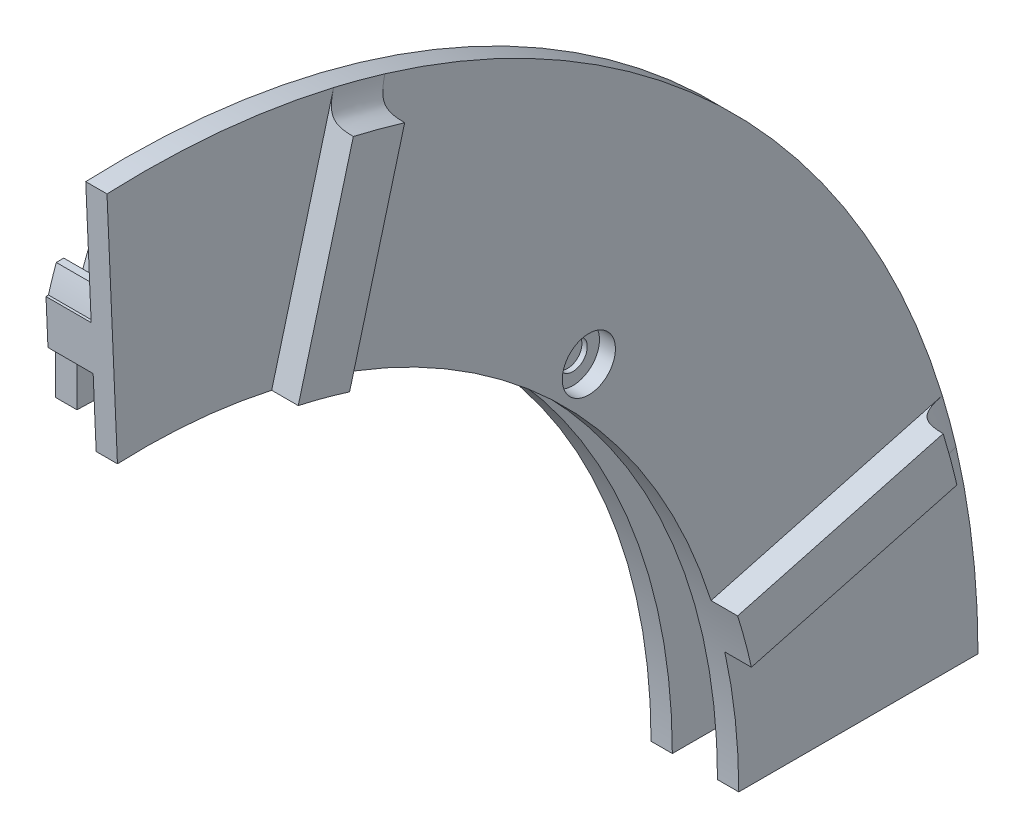
from build123d import *

# Parameters (mm, degrees)
BASPROSKE_W                                          = 8.5
BASPROSKE_H                                          = 138
TOOTHCUT_DEPTH                                       = 196.346487043
TEETHCUTS_COUNT                                      = 136
TEETHCUTS_ANGLE                                      = 357.352941176
BORSKE_R                                             = 0.1
BORE_DEPTH                                           = 50.0000508
TAGLIO_ESTRUSIONE1_DEPTH                             = 10
ESTRUSIONE_ESTRUSIONE1_DEPTH                         = 4
ESTRUSIONE_ESTRUSIONE2_START                         = 4
ESTRUSIONE_ESTRUSIONE2_DEPTH                         = 4
SMUSSO2_SIZE                                         = 4
FORO_LAMATO_PER_BULLONE_M12_A_TESTA_ESAG_D           = 5.4
FORO_LAMATO_PER_BULLONE_M12_A_TESTA_ESAG_DEPTH       = 18.1
FORO_LAMATO_PER_BULLONE_M12_A_TESTA_ESAG_CBORE_D     = 10
FORO_LAMATO_PER_BULLONE_M12_A_TESTA_ESAG_CBORE_DEPTH = 3
FORO_LAMATO_PER_BULLONE_M12_A_TESTA_ESAG_TIP         = 1.622323671
ESTRUSIONE_ESTRUSIONE3_DEPTH                         = 5
RACCORDO1_SIZE                                       = 5


# Some blends are built 0.0001 mm under size
with BuildPart() as part:
    # BasProSke → Base-Revolve (revolve)
    with BuildSketch(Plane(origin=(0, 0, 0), x_dir=(1, 0, 0), z_dir=(0, 1, 0)), mode=Mode.PRIVATE) as base_revolve_sk:
        with Locations((4.25, 69)):
            Rectangle(BASPROSKE_W, BASPROSKE_H)
    revolve(base_revolve_sk.sketch.rotate(Axis((-10, 0, 0), (1, 0, 0)), 180), axis=Axis((-10, 0, 0), (1, 0, 0)))

    # TooCutSke → ToothCut (cut, through all)
    with BuildSketch(Plane(origin=(0, 0, 0), x_dir=(0, 0, -1), z_dir=(1, 0, 0))):
        with BuildLine():
            ThreePointArc((0.801586668, 133.496593439), (0, 133.499), (-0.801586668, 133.496593439))
            ThreePointArc((-0.801586668, 133.496593439), (-1.603860234, 135.768497798), (-2.505945746, 138.002649544))
            ThreePointArc((-2.505945746, 138.002649544), (0, 138.0254), (2.505945746, 138.002649544))
            ThreePointArc((2.505945746, 138.002649544), (1.603860234, 135.768497798), (0.801586668, 133.496593439))
        make_face()
    toothcut = extrude(amount=TOOTHCUT_DEPTH, mode=Mode.SUBTRACT)

    # TeethCuts: ToothCut ×136 about axis
    teethcuts_axis = Axis((-10, 0, 0), (1, 0, 0))
    for i in range(1, TEETHCUTS_COUNT):
        add(toothcut.rotate(teethcuts_axis, i * TEETHCUTS_ANGLE / (TEETHCUTS_COUNT - 1)), mode=Mode.SUBTRACT)

    # BorSke → Bore (cut, symmetric)
    with BuildSketch(Plane(origin=(0, 0, 0), x_dir=(0, 0, -1), z_dir=(1, 0, 0))):
        with Locations(Location((0, 0, 0), (0, 0, 180))):
            Circle(BORSKE_R)
    extrude(amount=BORE_DEPTH, both=True, mode=Mode.SUBTRACT)

    # Schizzo1 → Taglio-Estrusione1 (cut)
    with BuildSketch(Plane(origin=(8.5, 0, 0), x_dir=(0, 0, -1), z_dir=(1, 0, 0))):
        with BuildLine():
            Line((-5.452423421, 124.881027698), (-6.106714231, 139.866751021))
            ThreePointArc((-6.106714231, 139.866751021), (-96.81182781, -101.130954688), (140, 0))
            Line((140, 0), (125, 0))
            ThreePointArc((125, 0), (86.439131973, 90.295495257), (-5.452423421, 124.881027698))
        make_face()
    extrude(amount=-TAGLIO_ESTRUSIONE1_DEPTH, mode=Mode.SUBTRACT)

    # Schizzo2 → Estrusione-Estrusione1 (add)
    with BuildSketch(Plane(origin=(8.5, 0, 0), x_dir=(0, 0, -1), z_dir=(1, 0, 0))):
        with BuildLine():
            Line((-6.848243816, 156.850570788), (-4.885371385, 111.893400817))
            ThreePointArc((-4.885371385, 111.893400817), (77.449462248, 80.904763751), (112, 0))
            Line((112, 0), (157, 0))
            ThreePointArc((157, 0), (108.567549758, 113.411142043), (-6.848243816, 156.850570788))
        make_face()
    extrude(amount=ESTRUSIONE_ESTRUSIONE1_DEPTH)

    # Schizzo3 → Estrusione-Estrusione2 (add)
    with BuildSketch(Plane.ZY.offset(ESTRUSIONE_ESTRUSIONE2_START)):
        with BuildLine():
            Line((-130, 0), (-112, 0))
            ThreePointArc((-112, 0), (-79.195959493, 79.195959493), (0, 112))
            Line((0, 112), (0, 130))
            ThreePointArc((0, 130), (-91.923881554, 91.923881554), (-130, 0))
        make_face()
    extrude(amount=-ESTRUSIONE_ESTRUSIONE2_DEPTH)

    # Smusso2
    smusso2_edges = [part.edges().sort_by_distance(p)[0] for p in [
        (-4, 91.923881554, -91.923881554),
    ]]
    chamfer(smusso2_edges, length=SMUSSO2_SIZE - 0.0001)  # a hair under: the kernel refuses the full size

    # Foro lamato per Bullone M12 a testa esagonale (Classe superiore)-1
    with Locations(Plane(origin=(12.5, 0, 0), x_dir=(0, 0, -1), z_dir=(1, 0, 0))):
        with Locations((83.792153571, 83.792153571)):
            CounterBoreHole(FORO_LAMATO_PER_BULLONE_M12_A_TESTA_ESAG_D / 2, FORO_LAMATO_PER_BULLONE_M12_A_TESTA_ESAG_CBORE_D / 2, FORO_LAMATO_PER_BULLONE_M12_A_TESTA_ESAG_CBORE_DEPTH, depth=FORO_LAMATO_PER_BULLONE_M12_A_TESTA_ESAG_DEPTH)
            with Locations((0, 0, -(FORO_LAMATO_PER_BULLONE_M12_A_TESTA_ESAG_DEPTH + FORO_LAMATO_PER_BULLONE_M12_A_TESTA_ESAG_TIP / 2))):  # 118° drill point
                Cone(0, FORO_LAMATO_PER_BULLONE_M12_A_TESTA_ESAG_D / 2, FORO_LAMATO_PER_BULLONE_M12_A_TESTA_ESAG_TIP, mode=Mode.SUBTRACT)

    # Schizzo6 → Estrusione-Estrusione3 (add)
    with BuildSketch(Plane(origin=(12.5, 0, 0), x_dir=(0, 0, -1), z_dir=(1, 0, 0))):
        with BuildLine():
            Line((24.129203459, 109.369929782), (34.489575502, 148.035364632))
            ThreePointArc((34.489575502, 148.035364632), (39.340494856, 146.820725596), (44.148833765, 145.447174181))
            Line((44.148833765, 145.447174181), (33.788461722, 106.781739331))
            ThreePointArc((33.788461722, 106.781739331), (28.987733051, 108.183692544), (24.129203459, 109.369929782))
        make_face()
        with BuildLine():
            Line((109.369929782, 24.129203459), (148.035364632, 34.489575502))
            ThreePointArc((148.035364632, 34.489575502), (146.820725596, 39.340494856), (145.447174181, 44.148833765))
            Line((145.447174181, 44.148833765), (106.781739331, 33.788461722))
            ThreePointArc((106.781739331, 33.788461722), (108.183692544, 28.987733051), (109.369929782, 24.129203459))
        make_face()
    extrude(amount=ESTRUSIONE_ESTRUSIONE3_DEPTH)

    # Raccordo1
    # a fillet whose section is not a circle: 5 mm, written as the material it adds along each edge
    with BuildSketch(Plane(origin=(12.5, 0, 0), x_dir=(0, 0.9892644198784396, -0.14613660582678942), z_dir=(0, 0.14613660582678942, 0.9892644198784396))) as raccordo1_piece_1_section:
        with BuildLine():
            Bezier((152 + RACCORDO1_SIZE, 0), (152, 0), (152, -RACCORDO1_SIZE), weights=[1, 1.5, 1])
            Line((152, -RACCORDO1_SIZE), (152, 0))
            Line((152, 0), (152 + RACCORDO1_SIZE, 0))
        make_face()
    raccordo1_piece_1 = revolve(axis=Axis((12.5, 0, 0), (-1, 0, 0)), revolution_arc=13.193793896, mode=Mode.PRIVATE)
    raccordo1_piece_1 = split(raccordo1_piece_1, bisect_by=Plane(origin=(12.5, -1.294095226, -4.829629131), z_dir=(0, 0.2588190451025217, 0.9659258262890681)), keep=Keep.TOP, mode=Mode.PRIVATE)
    raccordo1_piece_1 = split(raccordo1_piece_1, bisect_by=Plane(origin=(12.5, 1.294095226, 4.829629131), z_dir=(0, -0.25881904510252157, -0.9659258262890681)), keep=Keep.TOP, mode=Mode.PRIVATE)
    add(raccordo1_piece_1)
    with BuildSketch(Plane(origin=(12.5, 0, 0), x_dir=(0, 0.14613660582674254, -0.9892644198784465), z_dir=(0, -0.9892644198784465, -0.14613660582674254))) as raccordo1_piece_2_section:
        with BuildLine():
            Bezier((152 + RACCORDO1_SIZE, 0), (152, 0), (152, RACCORDO1_SIZE), weights=[1, 1.5, 1])
            Line((152, RACCORDO1_SIZE), (152, 0))
            Line((152, 0), (152 + RACCORDO1_SIZE, 0))
        make_face()
    raccordo1_piece_2 = revolve(axis=Axis((12.5, 0, 0), (1, 0, 0)), revolution_arc=13.193793896, mode=Mode.PRIVATE)
    raccordo1_piece_2 = split(raccordo1_piece_2, bisect_by=Plane(origin=(12.5, -4.829629131, -1.294095226), z_dir=(0, 0.9659258262890692, 0.25881904510251774)), keep=Keep.TOP, mode=Mode.PRIVATE)
    raccordo1_piece_2 = split(raccordo1_piece_2, bisect_by=Plane(origin=(12.5, 4.829629131, 1.294095225), z_dir=(0, -0.9659258262890691, -0.2588190451025181)), keep=Keep.TOP, mode=Mode.PRIVATE)
    add(raccordo1_piece_2)


solid = part.part
